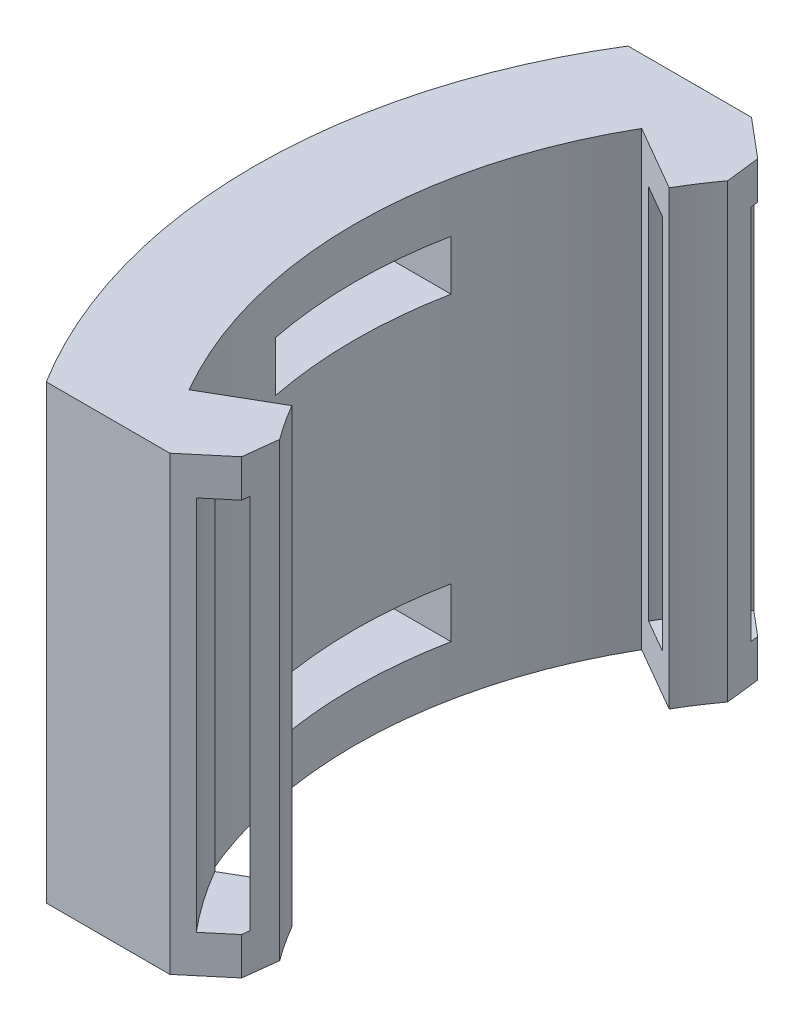
from build123d import *

# Parameters (mm, degrees)
BOSS_EXTRUDE1_DEPTH      = 30.3
CUT_EXTRUDE1_DEPTH       = 181.717957049
CUT_EXTRUDE7_DEPTH       = 27.29
CUT_EXTRUDE10_DEPTH      = 96
CUT_EXTRUDE11_DEPTH      = 48
SKETCH9_W                = 2
SKETCH9_H                = 7.4
BOSS_EXTRUDE2_DEPTH      = 1.5
FILLET8_R                = 1
CUT_EXTRUDE15_DEPTH      = 2.6
CUT_EXTRUDE15_DEPTH_BACK = 2.6
SKETCH10_W               = 29
SKETCH10_H               = 15.5
SKETCH11_W               = 3.45
SKETCH11_H               = 8
BOSS_EXTRUDE3_DEPTH      = 1.3
FILLET9_R                = 7
CUT_EXTRUDE18_DEPTH      = 2.5
CUT_EXTRUDE23_START      = -2.5
CUT_EXTRUDE23_DEPTH      = 2.5
SKETCH18_W               = 4.5
SKETCH18_H               = 15
SKETCH18_W_2             = 3.45
SKETCH18_H_2             = 8
CUT_EXTRUDE24_DEPTH      = 1
THICKEN1_START           = 2
THICKEN1_DEPTH           = 168
CUT_EXTRUDE25_DEPTH      = 174.737489032
CUT_EXTRUDE25_DEPTH_BACK = 174.737489032
SKETCH20_W               = 39.19521875
SKETCH20_H               = 150
CUT_EXTRUDE27_DEPTH      = 2
SKETCH21_3_W             = 7
SKETCH21_3_H             = 2
CUT_EXTRUDE28_DEPTH      = 30.97192195
SKETCH22_W               = 8
SKETCH22_H               = 18
CUT_EXTRUDE29_DEPTH      = 30.97192195
BOSS_EXTRUDE4_DEPTH      = 18
SKETCH27_W               = 1.5
SKETCH27_H               = 15


# Read off the part's stored shape, not the designer's step: Cut-Extrude23, Thicken1
# Some blends are built 0.0001 mm under size
with BuildPart() as part:
    # Sketch1 → Boss-Extrude1 (new body)
    with BuildSketch(Plane.XY):
        Polygon((34.45, 2), (35.7, 0), (53.3, 0), (53.3, 48), (45, 74), (45, 170), (0, 170), (0, 2), align=None)
    extrude(amount=BOSS_EXTRUDE1_DEPTH)

    # Sketch2 → Cut-Extrude1 (cut, through all)
    with BuildSketch(Plane(origin=(0, 170, 0), x_dir=(1, 0, 0), z_dir=(0, 1, 0))):
        with BuildLine():
            Line((0, -30.3), (9.25, -30.3))
            ThreePointArc((9.25, -30.3), (2.495291793, -24.025316905), (0, -15.150000022))
            Line((0, -15.150000022), (0, -30.3))
        make_face()
        with BuildLine():
            ThreePointArc((0, -15.150000022), (2.495291781, -6.274683113), (9.25, 0))
            Line((9.25, 0), (0, 0))
            Line((0, 0), (0, -15.150000022))
        make_face()
    extrude(amount=-CUT_EXTRUDE1_DEPTH, mode=Mode.SUBTRACT)

    # Sketch7 → Cut-Extrude7 (cut)
    with BuildSketch(Plane(origin=(-8.97657775, 28.11940018, 0), x_dir=(0, 0, -1), z_dir=(0.30411092373144827, -0.9526366285563479, 0))):
        with BuildLine():
            Line((-15.15, 65.372856641), (-30.3, 65.372856641))
            Line((-30.3, 65.372856641), (-30.3, 56.120928382))
            ThreePointArc((-30.3, 56.120928382), (-24.02581935, 62.876979624), (-15.15, 65.372856641))
        make_face()
        with BuildLine():
            Line((0, 65.372856641), (-15.15, 65.372856641))
            ThreePointArc((-15.15, 65.372856641), (-6.27418065, 62.876979624), (0, 56.120928382))
            Line((0, 56.120928382), (0, 65.372856641))
        make_face()
    extrude(amount=-CUT_EXTRUDE7_DEPTH, mode=Mode.SUBTRACT)

    # Sketch6 → Cut-Extrude10 (cut)
    with BuildSketch(Plane(origin=(0, 170, 0), x_dir=(1, 0, 0), z_dir=(0, 1, 0))):
        with BuildLine():
            Line((45, -15.15), (45, 0))
            Line((45, 0), (35.74807174, 0))
            ThreePointArc((35.74807174, 0), (42.504122982, -6.27418065), (45, -15.15))
        make_face()
        with BuildLine():
            Line((45, -30.3), (45, -15.15))
            ThreePointArc((45, -15.15), (42.504122982, -24.02581935), (35.74807174, -30.3))
            Line((35.74807174, -30.3), (45, -30.3))
        make_face()
    extrude(amount=-CUT_EXTRUDE10_DEPTH, mode=Mode.SUBTRACT)

    # Sketch4 → Cut-Extrude11 (cut)
    with BuildSketch(Plane.XZ):
        with BuildLine():
            Line((53.3, 15.15), (53.3, 30.3))
            Line((53.3, 30.3), (44.04807174, 30.3))
            ThreePointArc((44.04807174, 30.3), (50.804122982, 24.02581935), (53.3, 15.15))
        make_face()
        with BuildLine():
            Line((53.3, 0), (53.3, 15.15))
            ThreePointArc((53.3, 15.15), (50.804122982, 6.27418065), (44.04807174, 0))
            Line((44.04807174, 0), (53.3, 0))
        make_face()
    extrude(amount=-CUT_EXTRUDE11_DEPTH, mode=Mode.SUBTRACT)

    # Sketch9 → Boss-Extrude2 (add)
    with BuildSketch(Plane.XZ.offset(-2)):
        with Locations((3, 15.15)):
            Rectangle(SKETCH9_W, SKETCH9_H)
    extrude(amount=BOSS_EXTRUDE2_DEPTH)

    # Fillet8
    fillet8_edges = [part.edges().sort_by_distance(p)[0] for p in [
        (4, 1.25, 11.45),
        (2, 1.25, 11.45),
        (4, 1.25, 18.85),
        (2, 1.25, 18.85),
    ]]
    fillet(fillet8_edges, radius=FILLET8_R - 0.0001)  # a hair under: the kernel refuses the full size

    # Sketch10 → Cut-Extrude15 (cut, two sides: drawn at the far end of the back side and taken through both)
    with BuildSketch(Plane.XZ.offset(-2).offset(-CUT_EXTRUDE15_DEPTH_BACK)):
        with Locations((21, 15.15)):
            Rectangle(SKETCH10_W, SKETCH10_H)
    extrude(amount=CUT_EXTRUDE15_DEPTH + CUT_EXTRUDE15_DEPTH_BACK, mode=Mode.SUBTRACT)

    # Sketch11 → Boss-Extrude3 (add)
    with BuildSketch(Plane.XZ):
        with Locations((43.575, 15.15)):
            Rectangle(SKETCH11_W, SKETCH11_H)
    extrude(amount=BOSS_EXTRUDE3_DEPTH)

    # Fillet9
    # the kernel refuses this fillet: 7 mm, written as the material it takes off along each edge
    with BuildSketch(Plane(origin=(55.458124827, -1.3, 11.15), x_dir=(0, 1, 0), z_dir=(-1, 0, 0)), Plane(origin=(31.691875173, -1.3, 19.15), x_dir=(0, 1, 0), z_dir=(1, 0, 0))) as fillet9_piece_1:
        with BuildLine():
            CenterArc((7, -4.063249931), FILLET9_R, 144.516796045, 35.483203955)
            Line((0, -4.063249931), (-0.14, -4.063249931))
            Line((-0.14, -4.063249931), (-0.14, 0))
            Line((-0.14, 0), (0, 0.14))
            ThreePointArc((0, 0.14), (0.65, 0.14), (1.186, 0.081264999))
            Line((1.186, 0.081264999), (1.3, 0))
        make_face()
    extrude(amount=23.766249654, mode=Mode.SUBTRACT)

    # Sketch13 → Cut-Extrude18 (cut)
    with BuildSketch(Plane(origin=(0, 74, 0), x_dir=(1, 0, 0), z_dir=(0, 1, 0))):
        with BuildLine():
            Line((35.74807174, -30.3), (45, -30.3))
            Line((45, -30.3), (45, -15.15))
            ThreePointArc((45, -15.15), (42.504122982, -24.02581935), (35.74807174, -30.3))
        make_face()
    extrude(amount=-CUT_EXTRUDE18_DEPTH, mode=Mode.SUBTRACT)

    # Cut-Extrude23 outline → Cut-Extrude23 (cut)
    with BuildSketch(Plane(origin=(0, 74, 0), x_dir=(1, 0, 0), z_dir=(0, 1, 0)).offset(CUT_EXTRUDE23_START)):
        with BuildLine():
            ThreePointArc((44.999624541, -15.036915931), (44.999829684, -15.061319249), (45, -15.085722835))
            Line((45, -15.085722835), (45, 0))
            Line((45, 0), (35.74807174, 0))
            ThreePointArc((35.74807174, 0), (42.474573722, -6.225973939), (44.999624541, -15.036915931))
        make_face()
    extrude(amount=CUT_EXTRUDE23_DEPTH, mode=Mode.SUBTRACT)

    # Sketch18 → Cut-Extrude24 (cut)
    with BuildSketch(Plane.XZ):
        with Locations((43.575, 15.15)):
            Rectangle(SKETCH18_W, SKETCH18_H)
        with Locations((43.575, 15.15)):
            Rectangle(SKETCH18_W_2, SKETCH18_H_2, mode=Mode.SUBTRACT)
    extrude(amount=-CUT_EXTRUDE24_DEPTH, mode=Mode.SUBTRACT)


with BuildPart() as body_2:
    # Thicken1 outline → Thicken1 (new body)
    with BuildSketch(Plane(origin=(0, 0, 0), x_dir=(1, 0, 0), z_dir=(0, 1, 0)).offset(THICKEN1_START)):
        with BuildLine():
            Line((8.793107415, 0.889521875), (6.965537077, 4.447609375))
            ThreePointArc((6.965537077, 4.447609375), (-5, -15.15), (6.965537077, -34.747609375))
            Line((6.965537077, -34.747609375), (8.793107415, -31.189521875))
            ThreePointArc((8.793107415, -31.189521875), (-1, -15.15), (8.793107415, 0.889521875))
        make_face()
    extrude(amount=THICKEN1_DEPTH)

    # Sketch20 → Cut-Extrude25 (cut, two sides: drawn at the far end of the back side and taken through both)
    with BuildSketch(Plane(origin=(0, 0, 0), x_dir=(0, 0, -1), z_dir=(1, 0, 0)).offset(-CUT_EXTRUDE25_DEPTH_BACK)):
        with Locations((-15.15, 95)):
            Rectangle(SKETCH20_W, SKETCH20_H)
    extrude(amount=CUT_EXTRUDE25_DEPTH + CUT_EXTRUDE25_DEPTH_BACK, mode=Mode.SUBTRACT)

    # Sketch21 → Cut-Extrude27 (cut)
    with BuildSketch(Plane(origin=(-5, 20, 15.15), x_dir=(0, 0, 1), z_dir=(-1, 0, 0))):
        Polygon((-3.5, -3), (-6, -3), (-6, -9), (6, -9), (6, -3), (3.5, -3), (3.5, -4), (-3.5, -4), align=None)
        Polygon((6, -9), (-6, -9), (-6, -15), (-3.5, -15), (-3.5, -14), (3.5, -14), (3.5, -15), (6, -15), align=None)
    extrude(amount=-CUT_EXTRUDE27_DEPTH, mode=Mode.SUBTRACT)

    # Sketch21<3> → Cut-Extrude28 (cut, through all)
    with BuildSketch(Plane(origin=(-5, 20, 15.15), x_dir=(0, 0, 1), z_dir=(-1, 0, 0))):
        with Locations((0, -3)):
            Rectangle(SKETCH21_3_W, SKETCH21_3_H)
        with Locations((0, -15)):
            Rectangle(SKETCH21_3_W, SKETCH21_3_H)
    extrude(amount=-CUT_EXTRUDE28_DEPTH, mode=Mode.SUBTRACT)

    # Sketch22 → Cut-Extrude29 (cut, through all)
    with BuildSketch(Plane(origin=(-5, 20, 15.15), x_dir=(0, 0, 1), z_dir=(-1, 0, 0))):
        with Locations((15.597609375, -9)):
            Rectangle(SKETCH22_W, SKETCH22_H)
        with Locations((-15.597609375, -9)):
            Rectangle(SKETCH22_W, SKETCH22_H)
    extrude(amount=-CUT_EXTRUDE29_DEPTH, mode=Mode.SUBTRACT)

    # Sketch26 → Boss-Extrude4 (add, through all)
    with BuildSketch(Plane(origin=(0, 20, 0), x_dir=(1, 0, 0), z_dir=(0, 1, 0))):
        with BuildLine():
            ThreePointArc((1.420420678, -24.173845266), (2.266305947, -25.500112624), (3.224564184, -26.747609375))
            Line((3.224564184, -26.747609375), (5.521704906, -24.818064221))
            ThreePointArc((5.521704906, -24.818064221), (4.722876296, -23.778118977), (4.01772467, -22.672508539))
            Line((4.01772467, -22.672508539), (1.420420678, -24.173845266))
        make_face()
        with BuildLine():
            Line((5.521704906, -5.481935779), (3.224564184, -3.552390625))
            ThreePointArc((3.224564184, -3.552390625), (2.266305947, -4.799887376), (1.420420678, -6.126154734))
            Line((1.420420678, -6.126154734), (4.01772467, -7.627491461))
            ThreePointArc((4.01772467, -7.627491461), (4.722876296, -6.521881023), (5.521704906, -5.481935779))
        make_face()
    extrude(amount=-BOSS_EXTRUDE4_DEPTH)

    # Sketch27 → Cut-Revolve1 (revolve, cut)
    with BuildSketch(Plane(origin=(14.50695613, 0, 17.270660706), x_dir=(0.765713574037014, 0, -0.6431817181290699), z_dir=(0.6431817181290699, 0, 0.765713574037014))):
        with Locations((-13.234480788, 11)):
            Rectangle(SKETCH27_W, SKETCH27_H)
    revolve(axis=Axis((17.031621622, 2, 15.15), (0, 1, 0)), mode=Mode.SUBTRACT)

    # Chamfer1
    # the kernel refuses this chamfer: 1 mm, written as the material it takes off along each edge
    with BuildSketch(Plane(origin=(5.521704906, 22.495775164, 5.481935779), x_dir=(-0.5957324474314561, 0, 0.8031829499418718), z_dir=(0, -1, 0))) as chamfer1_piece_1:
        with BuildLine():
            Line((0.966778181, 0), (-0.087645206, 0.994455281))
            Line((-0.087645206, 0.994455281), (-0.107608652, 0.993246637))
            ThreePointArc((-0.107608652, 0.993246637), (-0.050117113, 0.496846553), (-0.019963446, -0.001208643))
            Line((-0.019963446, -0.001208643), (0.001208643, -0.019963446))
            ThreePointArc((0.001208643, -0.019963446), (0.48334789, 0.001454531), (0.966739217, -0.019999962))
            Line((0.966739217, -0.019999962), (0.966778181, 0))
        make_face()
    extrude(amount=22.991550328, mode=Mode.SUBTRACT)
    with BuildSketch(Plane(origin=(5.521704906, 22.495775164, 24.818064221), x_dir=(-0.7477801322117752, 0, 0.6639464390064458), z_dir=(0, -1, 0))) as chamfer1_piece_2:
        with BuildLine():
            Line((0.998310066, 0), (-0.084876909, 0.96304515))
            Line((-0.084876909, 0.96304515), (-0.104796224, 0.961250468))
            ThreePointArc((-0.104796224, 0.961250468), (-0.040985923, 0.481609232), (-0.019992472, -0.000548686))
            Line((-0.019992472, -0.000548686), (0.000548686, -0.019992472))
            ThreePointArc((0.000548686, -0.019992472), (0.499328034, -0.006303662), (0.998858751, -0.019992472))
            Line((0.998858751, -0.019992472), (0.998310066, 0))
        make_face()
    extrude(amount=22.991550328, mode=Mode.SUBTRACT)


solid = body_2.part
